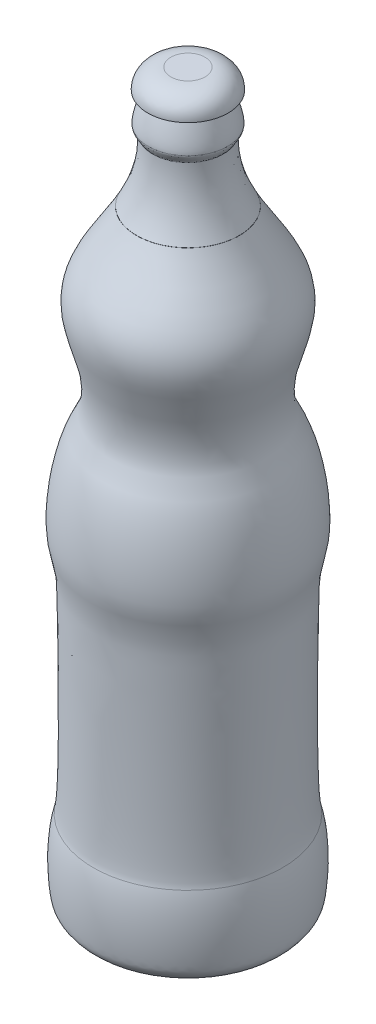
from build123d import *

# Parameters (mm, degrees)
REVOLU_O5_OUTLINE_W   = 1.827460177
REVOLU_O5_OUTLINE_H   = 2.116932432
REVOLU_O5_OUTLINE_H_2 = 75.742852164
REVOLU_O5_OUTLINE_W_2 = 1.569985989
ESBO_O4_R             = 0.5
CORTE_EXTRUS_O1_DEPTH = 0.4
ESBO_O5_R             = 13.841522626
CORTE_EXTRUS_O2_DEPTH = 0.01


# Read off the part's stored shape, not the designer's step: Revolução5
with BuildPart() as part:
    # Revolução5 outline → Revolução5 (revolve)
    with BuildSketch(Plane(origin=(113.550027708, 0, 0), x_dir=(1, 0, 0), z_dir=(0, 0, 1))):
        with Locations((0.913730089, 81.323833015)):
            Rectangle(REVOLU_O5_OUTLINE_W, REVOLU_O5_OUTLINE_H)
        with BuildLine():
            add(Edge.make_bspline(
                [(1.827460177, 82.382299231), (2.396824177, 82.382299231), (2.956262228, 82.230544133), (3.397446166, 81.935653126)],
                knots=[0, 0, 0, 0, 0.453971628, 0.453971628, 0.453971628, 0.453971628], degree=3))
            Line((1.827460177, 82.382299231), (1.827460177, 80.265366799))
            Line((1.827460177, 80.265366799), (3.397446166, 80.265366799))
            Line((3.397446166, 80.265366799), (3.397446166, 81.935653126))
        make_face()
        with Locations((0.913730089, 42.393940717)):
            Rectangle(REVOLU_O5_OUTLINE_W, REVOLU_O5_OUTLINE_H_2)
        with BuildLine():
            add(Edge.make_bspline(
                [(3.397446166, 81.935653126), (3.928093749, 81.580963874), (4.287665266, 81.019202518), (4.287665266, 80.265366799)],
                knots=[0.453971628, 0.453971628, 0.453971628, 0.453971628, 1, 1, 1, 1], degree=3))
            Line((3.397446166, 81.935653126), (3.397446166, 80.265366799))
            Line((3.397446166, 80.265366799), (4.287665266, 80.265366799))
        make_face()
        with Locations((2.612453172, 42.393940717)):
            Rectangle(REVOLU_O5_OUTLINE_W_2, REVOLU_O5_OUTLINE_H_2)
        with BuildLine():
            add(Edge.make_bspline(
                [(4.237280857, 77.164268874), (4.237280857, 77.991036533), (3.397446166, 80.265366799)],
                knots=[0, 0, 0, 1, 1, 1], degree=2))
            Line((3.397446166, 80.265366799), (3.397446166, 4.522514635))
            Line((3.397446166, 4.522514635), (4.287665266, 4.522514635))
            Line((4.287665266, 4.522514635), (4.287665266, 72.457444076))
            add(Edge.make_bspline(
                [(4.287665266, 72.457444076), (3.961064909, 73.58765697), (3.760556917, 74.823044372), (3.760556917, 76.195981291)],
                knots=[0.961243266, 0.961243266, 0.961243266, 0.961243266, 1, 1, 1, 1], degree=3))
            add(Edge.make_bspline(
                [(4.237280857, 77.164268874), (4.237280857, 76.853054458), (3.760556917, 76.323225481), (3.760556917, 76.195981291)],
                knots=[0, 0, 0, 0, 1, 1, 1, 1], degree=3))
        make_face()
        with BuildLine():
            add(Edge.make_bspline(
                [(8.519496768, 64.444336366), (7.268183444, 66.756061669), (5.240881847, 69.158802033), (4.287665266, 72.457444076)],
                knots=[0.84812777, 0.84812777, 0.84812777, 0.84812777, 0.961243266, 0.961243266, 0.961243266, 0.961243266], degree=3))
            Line((4.287665266, 72.457444076), (4.287665266, 4.522514635))
            Line((4.287665266, 4.522514635), (8.519496768, 4.522514635))
            Line((8.519496768, 4.522514635), (8.519496768, 49.892719519))
            add(Edge.make_bspline(
                [(8.519496768, 49.892719519), (8.457928336, 50.026563938), (7.881154401, 51.383320546), (7.960590125, 53.614584533), (8.406027333, 55.446493498), (8.519496768, 55.865686913)],
                knots=[0.627318125, 0.627318125, 0.627318125, 0.627318125, 0.63398847, 0.694021574, 0.712374035, 0.712374035, 0.712374035, 0.712374035], degree=3))
            Line((8.519496768, 55.865686913), (8.519496768, 64.444336366))
        make_face()
        with BuildLine():
            add(Edge.make_bspline(
                [(8.519496768, 55.865686913), (8.967484337, 57.520700347), (9.808147357, 59.659281256), (9.455899202, 62.497216925), (8.881218581, 63.776077303), (8.519496768, 64.444336366)],
                knots=[0.712374035, 0.712374035, 0.712374035, 0.712374035, 0.784831209, 0.815429052, 0.84812777, 0.84812777, 0.84812777, 0.84812777], degree=3))
            Line((8.519496768, 64.444336366), (8.519496768, 55.865686913))
        make_face()
        with BuildLine():
            add(Edge.make_bspline(
                [(10.11296668, 13.366850511), (9.680587596, 14.998404411), (9.77169133, 26.987490224), (9.956528705, 36.401383878), (10.619453546, 38.5071817), (10.716659656, 39.920189161), (10.72257141, 40.479788601), (10.722571409, 40.595489376)],
                knots=[0, 0, 0, 0, 0.36959093, 0.416737158, 0.465381711, 0.487047865, 0.4925728, 0.4925728, 0.4925728, 0.4925728], degree=3))
            add(Edge.make_bspline(
                [(10.722571409, 40.595489376), (10.722571405, 43.090880391), (10.090733242, 46.962675142), (8.663354398, 49.579985542), (8.519496768, 49.892719519)],
                knots=[0.4925728, 0.4925728, 0.4925728, 0.4925728, 0.611732541, 0.627318125, 0.627318125, 0.627318125, 0.627318125], degree=3))
            Line((8.519496768, 49.892719519), (8.519496768, 4.522514635))
            add(Edge.make_bspline(
                [(8.519496768, 4.522514635), (9.485381288, 4.522514635), (10.166782869, 5.41026998), (10.462289711, 6.274190939), (10.889338483, 10.437262822), (10.11296668, 13.366850511)],
                knots=[0, 0, 0, 0, 0.208168804, 0.249427649, 0.412588444, 0.412588444, 0.412588444, 0.412588444], degree=3))
        make_face()
    revolve(axis=Axis((113.550027708, 0, 0), (0, 1, 0)))

    # Esboço4 → Corte-extrusão1 (cut)
    with BuildSketch(Plane.XZ.offset(-4.522514635)):
        with Locations(Location((113.550027708, 0, 0), (0, 0, 270))):
            Circle(ESBO_O4_R)
    extrude(amount=-CORTE_EXTRUS_O1_DEPTH, mode=Mode.SUBTRACT)

    # Esboço5 → Corte-extrusão2 (cut)
    with BuildSketch(Plane(origin=(0, 69.522514635, 0), x_dir=(-1, 0, 0), z_dir=(0, -1, 0))):
        with Locations((-113.550027708, 0)):
            Circle(ESBO_O5_R)
    extrude(amount=-CORTE_EXTRUS_O2_DEPTH, mode=Mode.SUBTRACT)


with BuildPart() as corte_extrus_o2_piece_1:
    # of the separate pieces the step leaves, piece 1, a body of its own (corte_extrus_o2_pieces)
    add(part.part.solids().sort_by_distance((122.069524476, 64.444336366, 0))[0])


with BuildPart() as corte_extrus_o2_piece_2:
    # of the separate pieces the step leaves, piece 2, a body of its own (corte_extrus_o2_pieces)
    add(part.part.solids().sort_by_distance((115.377487885, 82.382299231, 0))[0])


solid = Compound([corte_extrus_o2_piece_1.part, corte_extrus_o2_piece_2.part])
